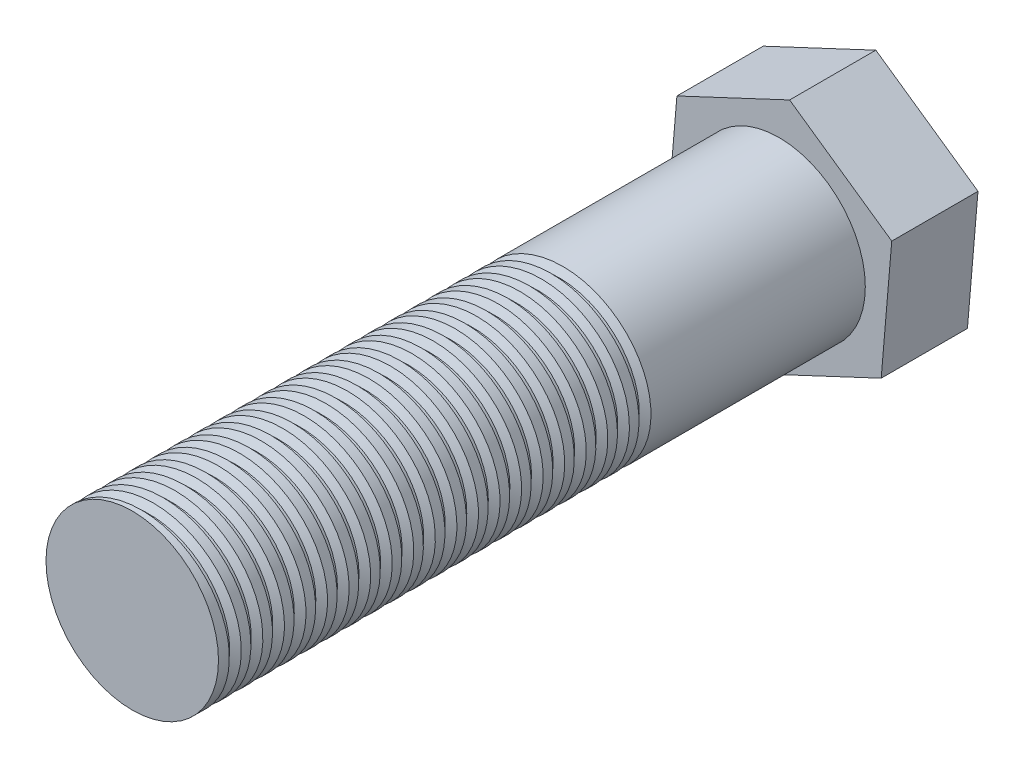
from build123d import *

# Parameters (mm, degrees)
BOSS_EXTRUDE1_DEPTH = 2
SKETCH2_R           = 2
BOSS_EXTRUDE2_DEPTH = 15
THREAD1_PITCH       = 0.5


with BuildPart() as part:
    # Sketch1 → Boss-Extrude1 (new body)
    with BuildSketch(Plane.XY):
        Polygon((2.613351748, 1.226265051), (0.244699188, 2.876361528), (-2.36865256, 1.650096477), (-2.613351748, -1.226265051), (-0.244699188, -2.876361528), (2.36865256, -1.650096477), align=None)
    extrude(amount=BOSS_EXTRUDE1_DEPTH)

    # Sketch2 → Boss-Extrude2 (add)
    with BuildSketch(Plane.XY.offset(2)):
        Circle(SKETCH2_R)
    extrude(amount=BOSS_EXTRUDE2_DEPTH)

    # Thread1: the profile of Thread Profile1 profile screwed along a right-hand helix of 20 turns, 6 arcs to a turn; built about Z, then put on its axis
    thread1_z = Axis((0, 0, 0), (0, 0, 1))
    thread1_corners = [(2.0003, 0, -0.000173205), (2.0003, 0, 0.277985704), (1.828148085, 0, 0.17859375), (1.828148085, 0, 0.09921875)]
    with BuildLine(mode=Mode.PRIVATE) as thread1_profile:
        Line(thread1_corners[0], thread1_corners[1])
        Line(thread1_corners[1], thread1_corners[2])
        Line(thread1_corners[2], thread1_corners[3])
        Line(thread1_corners[3], thread1_corners[0])
    thread1_cap = Face(thread1_profile.wire())
    thread1_turn_angles = [0, 30, 60, 90, 120, 150, 180, 210, 240, 270, 300, 330, 360]
    thread1_turn_weights = [1, 0.8660254037844387, 1, 0.8660254037844387, 1, 0.8660254037844387, 1, 0.8660254037844387, 1, 0.8660254037844387, 1, 0.8660254037844387, 1]
    thread1_turn_rails = [Edge.make_bspline([Vector(p[0], p[1], 0).rotate(thread1_z, thread1_turn_angles[k]) / thread1_turn_weights[k] + Vector(0, 0, p[2] + THREAD1_PITCH * thread1_turn_angles[k] / 360) for k in range(13)], [0, 0, 0, 1, 1, 2, 2, 3, 3, 4, 4, 5, 5, 6, 6, 6], 2, thread1_turn_weights) for p in thread1_corners]
    thread1_turn_sides = [Face.make_surface_from_curves(thread1_turn_rails[p[0]], thread1_turn_rails[p[1]]) for p in [(0, 1), (1, 2), (2, 3), (3, 0)]]
    thread1 = Plane(origin=(0, 0, 17), x_dir=(-1, 0, 0), z_dir=(0, 0, -1)) * Solid(Shell([*[p.moved(Location((0, 0, THREAD1_PITCH * i))) for i in range(20) for p in thread1_turn_sides], thread1_cap, thread1_cap.rotate(thread1_z, 7200).moved(Location((0, 0, THREAD1_PITCH * 7200 / 360)))]))
    add(thread1, mode=Mode.SUBTRACT)


solid = part.part
